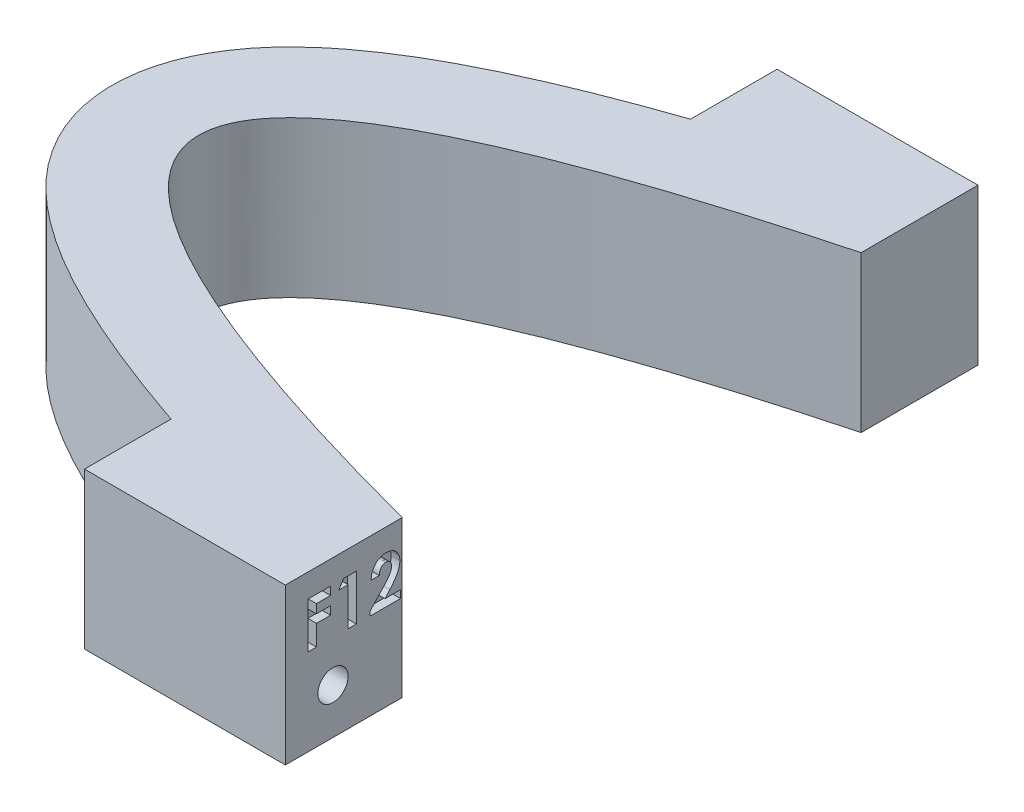
from build123d import *
from OCP.BRepAlgoAPI import BRepAlgoAPI_Cut
from OCP.TopTools import TopTools_ListOfShape

# Parameters (mm, degrees)
BOSS_EXTRUDE1_DEPTH = 18
SKETCH2_R           = 1.75
CUT_EXTRUDE1_DEPTH  = 79.899052368
CUT_EXTRUDE2_DEPTH  = 1
CUT_EXTRUDE3_START  = -53.96289
CUT_EXTRUDE3_DEPTH  = 5


with BuildPart() as part:
    # Sketch1 → Boss-Extrude1 (new body)
    with BuildSketch(Plane(origin=(0, 0, 0), x_dir=(1, 0, 0), z_dir=(0, 1, 0))):
        with BuildLine():
            Line((-0.035806527, 32.028571429), (-23.239172358, 32.028571429))
            Line((-23.239172358, 32.028571429), (-23.239172358, 22.028571429))
            add(Edge.make_bspline(
                [(-23.239652544, -37.971428571), (-29.137142946, -35.957737039), (-39.04083373, -31.793462695), (-47.16650815, -27.380684298), (-52.63340692, -23.138434647), (-56.343593841, -19.135197292), (-58.804783828, -14.740184146), (-59.821496461, -11.074078946), (-60.10725197, -7.97116121), (-59.821443943, -4.868249056), (-58.804670602, -1.202163133), (-56.343411393, 3.192806984), (-52.633163529, 7.195986519), (-47.166199461, 11.438156728), (-39.040454765, 15.850822153), (-29.136696082, 20.01496049), (-23.239172358, 22.028571429)],
                knots=[0.112490085, 0.112490085, 0.112490085, 0.185147633, 0.257805181, 0.330462729, 0.378901094, 0.42733946, 0.463668234, 0.487887416, 0.512106599, 0.536325781, 0.572654555, 0.621092921, 0.669531286, 0.742188834, 0.814846382, 0.88750393, 0.88750393, 0.88750393], degree=2))
            Line((-23.239652544, -37.971428571), (-23.239652544, -47.971428571))
            Line((-23.239652544, -47.971428571), (-0.037452549, -47.971428571))
            Line((-0.037452549, -47.971428571), (-0.037452549, -34.471428546))
            add(Edge.make_bspline(
                [(-0.037452549, -34.471428546), (-100.034983512, -7.970747495), (-0.035806527, 18.528571429)],
                knots=[0, 0, 0, 1, 1, 1], degree=2))
            Line((-0.035806527, 18.528571429), (-0.035806527, 32.028571429))
        make_face()
    extrude(amount=BOSS_EXTRUDE1_DEPTH)

    # Sketch2 → Cut-Extrude1 (cut, through all)
    with BuildSketch(Plane(origin=(-0.037452549, 0, 0), x_dir=(0, 0, -1), z_dir=(1, 0, 0))):
        with Locations((-42.471428571, 5.25)):
            Circle(SKETCH2_R)
        with Locations((27.528571429, 5.25)):
            Circle(SKETCH2_R)
    extrude(amount=-CUT_EXTRUDE1_DEPTH, mode=Mode.SUBTRACT)

    # Sketch3 → Cut-Extrude2 (cut)
    with BuildSketch(Plane(origin=(-0.037452549, 0, 0), x_dir=(0, 0, -1), z_dir=(1, 0, 0))):
        Polygon((-45.326710591, 15.291960871), (-42.748719138, 15.291960871), (-42.748719138, 14.342174546), (-44.376924266, 14.342174546), (-44.376924266, 13.324546341), (-42.748719138, 13.324546341), (-42.748719138, 12.374760016), (-44.376924266, 12.374760016), (-44.376924266, 10.000294204), (-45.326710591, 10.000294204), align=None)
        Polygon((-41.231817095, 15.291960871), (-39.763676403, 15.291960871), (-39.763676403, 10.000294204), (-40.713462728, 10.000294204), (-40.713462728, 14.410016426), (-41.798932813, 14.410016426), align=None)
        with BuildLine():
            Line((-37.117843069, 13.528071982), (-38.067629394, 13.528071982))
            add(Edge.make_bspline(
                [(-38.067629394, 13.528071982), (-38.063527413, 13.599918293), (-38.055512387, 13.74030167), (-38.023630642, 13.944213021), (-37.980910196, 14.136886824), (-37.923894091, 14.317649087), (-37.852249624, 14.486434125), (-37.767820393, 14.643817335), (-37.668449421, 14.788970093), (-37.55625165, 14.921192389), (-37.43313189, 15.039810231), (-37.301646228, 15.144984262), (-37.159783413, 15.231771225), (-37.010135395, 15.30318886), (-36.852727656, 15.360248233), (-36.686070872, 15.398397041), (-36.511608047, 15.424231787), (-36.392174115, 15.426492431), (-36.331301269, 15.427644632)],
                knots=[0, 0, 0, 0, 1.199038563, 2.342849363, 3.436047546, 4.486744587, 5.497670872, 6.488682221, 7.459191391, 8.424610317, 9.374430501, 10.305433194, 11.225809216, 12.140057399, 13.06607119, 14.010487599, 14.985989317, 16, 16, 16, 16], degree=3))
            add(Edge.make_bspline(
                [(-36.331301269, 15.427644632), (-36.256580714, 15.425313153), (-36.11070868, 15.420761561), (-35.898745044, 15.381934971), (-35.700794183, 15.316991498), (-35.516999989, 15.22624834), (-35.348927135, 15.11096867), (-35.196603491, 14.973516529), (-35.064635567, 14.811008102), (-34.952186649, 14.630205097), (-34.858755036, 14.43876016), (-34.793282054, 14.240798157), (-34.750247368, 14.041572196), (-34.745657452, 13.907423518), (-34.743377257, 13.840780649)],
                knots=[0, 0, 0, 0, 1.075374347, 2.099382735, 3.09057751, 4.06680945, 5.040638231, 6.016817125, 7.011024321, 8.044445721, 9.0776792, 10.070479129, 11.0414456, 12, 12, 12, 12], degree=3))
            add(Edge.make_bspline(
                [(-34.743377257, 13.840780649), (-34.744265045, 13.800470332), (-34.746051942, 13.719335621), (-34.758476474, 13.59655889), (-34.777115727, 13.471496435), (-34.805219179, 13.344255486), (-34.840266487, 13.214800374), (-34.882783937, 13.082743686), (-34.933757764, 12.948834133), (-34.992337317, 12.811564588), (-35.062222873, 12.67048939), (-35.143594888, 12.523493766), (-35.238613161, 12.370708113), (-35.346129991, 12.211269753), (-35.46666756, 12.045430147), (-35.600814295, 11.873688853), (-35.747025138, 11.695440711), (-35.850795087, 11.576291832), (-35.904109429, 11.515076189)],
                knots=[0, 0, 0, 0, 0.728284026, 1.46585585, 2.227944881, 3.01186502, 3.81876927, 4.650621989, 5.517437689, 6.406905708, 7.346299482, 8.360816762, 9.441613733, 10.596154504, 11.834900912, 13.145207542, 14.533280747, 16, 16, 16, 16], degree=3))
            Line((-35.904109429, 11.515076189), (-36.456384736, 10.882238649))
            Line((-36.456384736, 10.882238649), (-34.675535377, 10.882238649))
            Line((-34.675535377, 10.882238649), (-34.675535377, 10.000294204))
            Line((-34.675535377, 10.000294204), (-38.203313155, 10.000294204))
            Line((-38.203313155, 10.000294204), (-38.203313155, 10.481547543))
            Line((-38.203313155, 10.481547543), (-36.636589731, 12.148973758))
            add(Edge.make_bspline(
                [(-36.636589731, 12.148973758), (-36.591229062, 12.197613099), (-36.503378897, 12.291813077), (-36.378377167, 12.430155767), (-36.265261642, 12.561439677), (-36.166377867, 12.687062717), (-36.076536547, 12.802950186), (-35.999743701, 12.912595077), (-35.935296732, 13.015006161), (-35.865330408, 13.138496043), (-35.798885399, 13.285779701), (-35.737918082, 13.455456515), (-35.700754283, 13.617628471), (-35.695624504, 13.723303204), (-35.693163582, 13.773998798)],
                knots=[0, 0, 0, 0, 1.246127091, 2.413378631, 3.493388633, 4.492180848, 5.408488754, 6.240484944, 6.999099869, 7.674939598, 8.898438119, 10.020720584, 11.050475521, 12, 12, 12, 12], degree=3))
            add(Edge.make_bspline(
                [(-35.693163582, 13.773998798), (-35.695003554, 13.823042874), (-35.698568794, 13.918073635), (-35.73774789, 14.053254385), (-35.798445506, 14.175646756), (-35.883977019, 14.281593523), (-35.987582469, 14.368657008), (-36.107308298, 14.433412381), (-36.24217839, 14.470775935), (-36.336724893, 14.475452517), (-36.385362768, 14.477858307)],
                knots=[0, 0, 0, 0, 1.062038974, 2.057870785, 3.028805853, 4.01125022, 4.991535629, 5.949134679, 6.94496649, 8, 8, 8, 8], degree=3))
            add(Edge.make_bspline(
                [(-36.385362768, 14.477858307), (-36.410489713, 14.476969579), (-36.45995614, 14.475219976), (-36.532667922, 14.463573343), (-36.601858406, 14.443047367), (-36.668297721, 14.415545449), (-36.73127681, 14.379091459), (-36.790636819, 14.334156109), (-36.84700318, 14.281881307), (-36.900117375, 14.222430511), (-36.948458227, 14.156083404), (-36.991394395, 14.083445933), (-37.026895457, 14.004563186), (-37.058151883, 13.920476535), (-37.082258335, 13.830282821), (-37.099810822, 13.734521843), (-37.113154806, 13.633349392), (-37.116251886, 13.563802846), (-37.117843069, 13.528071982)],
                knots=[0, 0, 0, 0, 0.903469896, 1.778625579, 2.63899355, 3.493148037, 4.358286772, 5.247621495, 6.164656832, 7.118446693, 8.109501108, 9.111810964, 10.146451449, 11.215617525, 12.33435995, 13.498009769, 14.714554818, 16, 16, 16, 16], degree=3))
        make_face()
    extrude(amount=-CUT_EXTRUDE2_DEPTH, mode=Mode.SUBTRACT)


with BuildPart() as cut_extrude3_tool:
    # Sketch4 → Cut-Extrude3 (new body)
    with BuildSketch(Plane.ZY.offset(77.202542215).offset(CUT_EXTRUDE3_START)):
        Polygon((-25.391799088, 2.901056132), (-24.425940196, 5.926027195), (-26.562712537, 8.274971063), (-29.665343769, 7.598943868), (-30.631202661, 4.573972805), (-28.49443032, 2.225028937), align=None)
        Polygon((44.716794169, 3.004634402), (45.538655018, 6.071860849), (43.293289421, 8.317226447), (40.226062974, 7.495365598), (39.404202124, 4.428139151), (41.649567722, 2.182773553), align=None)
    extrude(amount=-CUT_EXTRUDE3_DEPTH)


with BuildPart() as part_1:
    add(part.part)

    # Cut-Extrude3: cut by cut_extrude3_tool, with a tolerance
    cut_extrude3_stock = TopTools_ListOfShape()
    cut_extrude3_stock.Append(part_1.part.wrapped)
    cut_extrude3_tools = TopTools_ListOfShape()
    cut_extrude3_tools.Append(cut_extrude3_tool.part.wrapped)
    cut_extrude3_cut = BRepAlgoAPI_Cut()
    cut_extrude3_cut.SetArguments(cut_extrude3_stock)
    cut_extrude3_cut.SetTools(cut_extrude3_tools)
    cut_extrude3_cut.SetFuzzyValue(0.00001)
    cut_extrude3_cut.Build()
    add(Compound.cast(cut_extrude3_cut.Shape()).solids(), mode=Mode.REPLACE)


solid = part_1.part
